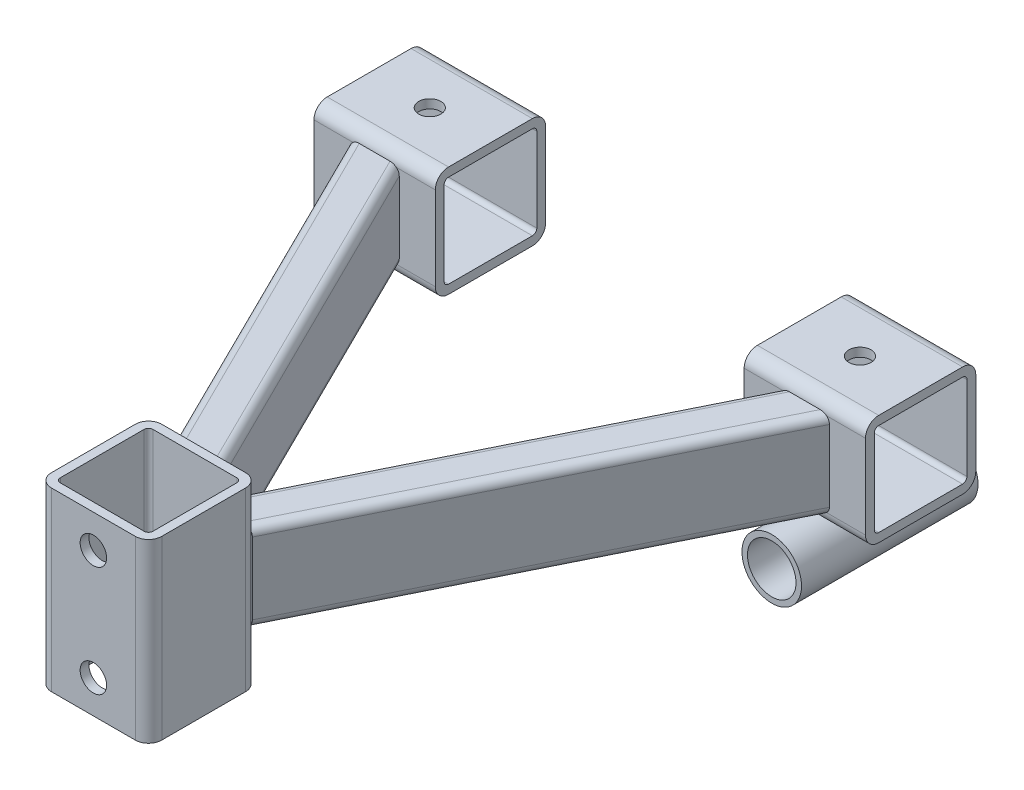
from build123d import *

# Parameters (mm, degrees)
BXBXS_8639_82_50_X_50_X_4_1_DEPTH     = 55
BXBXS_8639_82_50_X_50_X_4_1_2_DEPTH   = 55
AXBXS_8645_68_40_X_20_X_2_5_1_DEPTH   = 266.089245937
AXBXS_8645_68_40_X_20_X_2_5_1_2_DEPTH = 266.089245937
BODY_START                            = 266.089246039
BODY_4_RUN_ON_DEPTH                   = 57.009711
BODY_START_2                          = -2e-09
BODY_3_RUN_ON_DEPTH                   = 57.009711
BXBXS_8639_82_50_X_50_X_4_2_DEPTH     = 80
BODY_START_3                          = 150.660137769
BODY_3_RUN_ON_2_DEPTH                 = 102.6688631
BODY_START_4                          = 115.429108279
BODY_4_RUN_ON_2_DEPTH                 = 102.6688631
SKETCH_9_R                            = 6
CUT_EXTRUDE_1_DEPTH                   = 4
EXTRUDE_1_DEPTH                       = 40
EXTRUDE_1_DEPTH_BACK                  = 40
SKETCH_10_R                           = 13.5
SKETCH_10_R_2                         = 11
CUT_EXTRUDE_2_REACH                   = 296.26
CUT_EXTRUDE_2_END_RADIUS              = 11
SKETCH_11_R                           = 5
SKETCH_12_R                           = 5
CUT_EXTRUDE_3_DEPTH                   = 4


with BuildPart() as part:
    # Sketch1 → Труба bxbxs гост8639-82 50 X 50 X 4(1) (new body)
    with BuildSketch(Plane.ZY.offset(70)):
        with BuildLine():
            Line((-19, -25), (19, -25))
            ThreePointArc((19, -25), (23.242640687, -23.242640687), (25, -19))
            Line((25, -19), (25, 19))
            ThreePointArc((25, 19), (23.242640687, 23.242640687), (19, 25))
            Line((19, 25), (-19, 25))
            ThreePointArc((-19, 25), (-23.242640687, 23.242640687), (-25, 19))
            Line((-25, 19), (-25, -19))
            ThreePointArc((-25, -19), (-23.242640687, -23.242640687), (-19, -25))
        make_face()
        with BuildLine():
            Line((-19, -21), (19, -21))
            ThreePointArc((19, -21), (20.414213562, -20.414213562), (21, -19))
            Line((21, -19), (21, 19))
            ThreePointArc((21, 19), (20.414213562, 20.414213562), (19, 21))
            Line((19, 21), (-19, 21))
            ThreePointArc((-19, 21), (-20.414213562, 20.414213562), (-21, 19))
            Line((-21, 19), (-21, -19))
            ThreePointArc((-21, -19), (-20.414213562, -20.414213562), (-19, -21))
        make_face(mode=Mode.SUBTRACT)
    extrude(amount=BXBXS_8639_82_50_X_50_X_4_1_DEPTH)


with BuildPart() as body_2:
    # Sketch1 on segment 2 (carried to segment 2) → bxbxs _8639-82 50 X 50 X 4_1 2 (new body)
    with BuildSketch(Plane.ZY.offset(-125)):
        with BuildLine():
            Line((-19, -25), (19, -25))
            ThreePointArc((19, -25), (23.242640687, -23.242640687), (25, -19))
            Line((25, -19), (25, 19))
            ThreePointArc((25, 19), (23.242640687, 23.242640687), (19, 25))
            Line((19, 25), (-19, 25))
            ThreePointArc((-19, 25), (-23.242640687, 23.242640687), (-25, 19))
            Line((-25, 19), (-25, -19))
            ThreePointArc((-25, -19), (-23.242640687, -23.242640687), (-19, -25))
        make_face()
        with BuildLine():
            Line((-19, -21), (19, -21))
            ThreePointArc((19, -21), (20.414213562, -20.414213562), (21, -19))
            Line((21, -19), (21, 19))
            ThreePointArc((21, 19), (20.414213562, 20.414213562), (19, 21))
            Line((19, 21), (-19, 21))
            ThreePointArc((-19, 21), (-20.414213562, 20.414213562), (-21, 19))
            Line((-21, 19), (-21, -19))
            ThreePointArc((-21, -19), (-20.414213562, -20.414213562), (-19, -21))
        make_face(mode=Mode.SUBTRACT)
    extrude(amount=BXBXS_8639_82_50_X_50_X_4_1_2_DEPTH)


with BuildPart() as body_3:
    # Sketch11 → Труба axbxs гост8645-68 40 X 20 X 2.5(1) (new body)
    with BuildSketch(Plane(origin=(-97.5, 0, 25), x_dir=(0.8963205535774442, 0, -0.44340665898768833), z_dir=(0.44340665898768833, 0, 0.8963205535774442))):
        with BuildLine():
            Line((-6.25, -20), (6.25, -20))
            ThreePointArc((6.25, -20), (8.901650429, -18.901650429), (10, -16.25))
            Line((10, -16.25), (10, 16.25))
            ThreePointArc((10, 16.25), (8.901650429, 18.901650429), (6.25, 20))
            Line((6.25, 20), (-6.25, 20))
            ThreePointArc((-6.25, 20), (-8.901650429, 18.901650429), (-10, 16.25))
            Line((-10, 16.25), (-10, -16.25))
            ThreePointArc((-10, -16.25), (-8.901650429, -18.901650429), (-6.25, -20))
        make_face()
        with BuildLine():
            Line((-6.25, -17.5), (6.25, -17.5))
            ThreePointArc((6.25, -17.5), (7.133883476, -17.133883476), (7.5, -16.25))
            Line((7.5, -16.25), (7.5, 16.25))
            ThreePointArc((7.5, 16.25), (7.133883476, 17.133883476), (6.25, 17.5))
            Line((6.25, 17.5), (-6.25, 17.5))
            ThreePointArc((-6.25, 17.5), (-7.133883476, 17.133883476), (-7.5, 16.25))
            Line((-7.5, 16.25), (-7.5, -16.25))
            ThreePointArc((-7.5, -16.25), (-7.133883476, -17.133883476), (-6.25, -17.5))
        make_face(mode=Mode.SUBTRACT)
    extrude(amount=AXBXS_8645_68_40_X_20_X_2_5_1_DEPTH)

    # Труба axbxs гост8645-68 40 X 20 X 2.5(1) mitre 1
    split(bisect_by=Plane(origin=(0, 0, 222.090531237), x_dir=(0, -1, 0), z_dir=(-1, 0, 0)), keep=Keep.TOP)

    # Sketch11 → body 3 run on (add)
    with BuildSketch(Plane(origin=(-97.5, 0, 25), x_dir=(0.8963205535774442, 0, -0.44340665898768833), z_dir=(0.44340665898768833, 0, 0.8963205535774442)).offset(BODY_START_2)):
        with BuildLine():
            Line((-6.25, -20), (6.25, -20))
            ThreePointArc((6.25, -20), (8.901650429, -18.901650429), (10, -16.25))
            Line((10, -16.25), (10, 16.25))
            ThreePointArc((10, 16.25), (8.901650429, 18.901650429), (6.25, 20))
            Line((6.25, 20), (-6.25, 20))
            ThreePointArc((-6.25, 20), (-8.901650429, 18.901650429), (-10, 16.25))
            Line((-10, 16.25), (-10, -16.25))
            ThreePointArc((-10, -16.25), (-8.901650429, -18.901650429), (-6.25, -20))
        make_face()
        with BuildLine():
            Line((-6.25, -17.5), (6.25, -17.5))
            ThreePointArc((6.25, -17.5), (7.133883476, -17.133883476), (7.5, -16.25))
            Line((7.5, -16.25), (7.5, 16.25))
            ThreePointArc((7.5, 16.25), (7.133883476, 17.133883476), (6.25, 17.5))
            Line((6.25, 17.5), (-6.25, 17.5))
            ThreePointArc((-6.25, 17.5), (-7.133883476, 17.133883476), (-7.5, 16.25))
            Line((-7.5, 16.25), (-7.5, -16.25))
            ThreePointArc((-7.5, -16.25), (-7.133883476, -17.133883476), (-6.25, -17.5))
        make_face(mode=Mode.SUBTRACT)
    extrude(amount=-BODY_3_RUN_ON_DEPTH)

    # Weld Trim 3 5
    split(bisect_by=Plane(origin=(-97.5, 0, 25), x_dir=(0, -1, 0), z_dir=(0, 0, 1)), keep=Keep.TOP)

    # body 3 cut square before the run-on
    split(bisect_by=Plane(origin=(-30.696291668, 0, 160.03977815), x_dir=(0, -1, 0), z_dir=(-0.443406659, 0, -0.896320554)), keep=Keep.TOP)

    # Sketch11 → body 3 run on 2 (add)
    with BuildSketch(Plane(origin=(-97.5, 0, 25), x_dir=(0.8963205535774442, 0, -0.44340665898768833), z_dir=(0.44340665898768833, 0, 0.8963205535774442)).offset(BODY_START_3)):
        with BuildLine():
            Line((-6.25, -20), (6.25, -20))
            ThreePointArc((6.25, -20), (8.901650429, -18.901650429), (10, -16.25))
            Line((10, -16.25), (10, 16.25))
            ThreePointArc((10, 16.25), (8.901650429, 18.901650429), (6.25, 20))
            Line((6.25, 20), (-6.25, 20))
            ThreePointArc((-6.25, 20), (-8.901650429, 18.901650429), (-10, 16.25))
            Line((-10, 16.25), (-10, -16.25))
            ThreePointArc((-10, -16.25), (-8.901650429, -18.901650429), (-6.25, -20))
        make_face()
        with BuildLine():
            Line((-6.25, -17.5), (6.25, -17.5))
            ThreePointArc((6.25, -17.5), (7.133883476, -17.133883476), (7.5, -16.25))
            Line((7.5, -16.25), (7.5, 16.25))
            ThreePointArc((7.5, 16.25), (7.133883476, 17.133883476), (6.25, 17.5))
            Line((6.25, 17.5), (-6.25, 17.5))
            ThreePointArc((-6.25, 17.5), (-7.133883476, 17.133883476), (-7.5, 16.25))
            Line((-7.5, 16.25), (-7.5, -16.25))
            ThreePointArc((-7.5, -16.25), (-7.133883476, -17.133883476), (-6.25, -17.5))
        make_face(mode=Mode.SUBTRACT)
    extrude(amount=BODY_3_RUN_ON_2_DEPTH)

    # Weld Trim 4
    split(bisect_by=Plane.YX.offset(-200), keep=Keep.TOP)


with BuildPart() as body_4:
    # Sketch11 on segment 2 (carried to segment 2) → axbxs _8645-68 40 X 20 X 2.5_1 2 (new body)
    with BuildSketch(Plane(origin=(-20.485743533, 0, 263.501260219), x_dir=(-0.896320554, 0, -0.443406659), z_dir=(0.443406659, 0, -0.896320554))):
        with BuildLine():
            Line((-6.25, -20), (6.25, -20))
            ThreePointArc((6.25, -20), (8.901650429, -18.901650429), (10, -16.25))
            Line((10, -16.25), (10, 16.25))
            ThreePointArc((10, 16.25), (8.901650429, 18.901650429), (6.25, 20))
            Line((6.25, 20), (-6.25, 20))
            ThreePointArc((-6.25, 20), (-8.901650429, 18.901650429), (-10, 16.25))
            Line((-10, 16.25), (-10, -16.25))
            ThreePointArc((-10, -16.25), (-8.901650429, -18.901650429), (-6.25, -20))
        make_face()
        with BuildLine():
            Line((-6.25, -17.5), (6.25, -17.5))
            ThreePointArc((6.25, -17.5), (7.133883476, -17.133883476), (7.5, -16.25))
            Line((7.5, -16.25), (7.5, 16.25))
            ThreePointArc((7.5, 16.25), (7.133883476, 17.133883476), (6.25, 17.5))
            Line((6.25, 17.5), (-6.25, 17.5))
            ThreePointArc((-6.25, 17.5), (-7.133883476, 17.133883476), (-7.5, 16.25))
            Line((-7.5, 16.25), (-7.5, -16.25))
            ThreePointArc((-7.5, -16.25), (-7.133883476, -17.133883476), (-6.25, -17.5))
        make_face(mode=Mode.SUBTRACT)
    extrude(amount=AXBXS_8645_68_40_X_20_X_2_5_1_2_DEPTH)

    # axbxs _8645-68 40 X 20 X 2.5_1 2 mitre 1
    split(bisect_by=Plane(origin=(0, 0, 222.090531237), x_dir=(0, 1, 0), z_dir=(1, 0, 0)), keep=Keep.TOP)

    # Sketch11 on segment 2 (carried to segment 2) → body 4 run on (add)
    with BuildSketch(Plane(origin=(-20.485743533, 0, 263.501260219), x_dir=(-0.896320554, 0, -0.443406659), z_dir=(0.443406659, 0, -0.896320554)).offset(BODY_START)):
        with BuildLine():
            Line((-6.25, -20), (6.25, -20))
            ThreePointArc((6.25, -20), (8.901650429, -18.901650429), (10, -16.25))
            Line((10, -16.25), (10, 16.25))
            ThreePointArc((10, 16.25), (8.901650429, 18.901650429), (6.25, 20))
            Line((6.25, 20), (-6.25, 20))
            ThreePointArc((-6.25, 20), (-8.901650429, 18.901650429), (-10, 16.25))
            Line((-10, 16.25), (-10, -16.25))
            ThreePointArc((-10, -16.25), (-8.901650429, -18.901650429), (-6.25, -20))
        make_face()
        with BuildLine():
            Line((-6.25, -17.5), (6.25, -17.5))
            ThreePointArc((6.25, -17.5), (7.133883476, -17.133883476), (7.5, -16.25))
            Line((7.5, -16.25), (7.5, 16.25))
            ThreePointArc((7.5, 16.25), (7.133883476, 17.133883476), (6.25, 17.5))
            Line((6.25, 17.5), (-6.25, 17.5))
            ThreePointArc((-6.25, 17.5), (-7.133883476, 17.133883476), (-7.5, 16.25))
            Line((-7.5, 16.25), (-7.5, -16.25))
            ThreePointArc((-7.5, -16.25), (-7.133883476, -17.133883476), (-6.25, -17.5))
        make_face(mode=Mode.SUBTRACT)
    extrude(amount=BODY_4_RUN_ON_DEPTH)

    # Weld Trim 2 5
    split(bisect_by=Plane(origin=(97.5, 0, 25), x_dir=(0, -1, 0), z_dir=(0, 0, 1)), keep=Keep.TOP)

    # body 4 cut square before the run-on
    split(bisect_by=Plane(origin=(30.69629172, 0, 160.039777939), x_dir=(0, 1, 0), z_dir=(0.443406659, 0, -0.896320554)), keep=Keep.TOP)

    # Sketch11 on segment 2 (carried to segment 2) → body 4 run on 2 (add)
    with BuildSketch(Plane(origin=(-20.485743533, 0, 263.501260219), x_dir=(-0.896320554, 0, -0.443406659), z_dir=(0.443406659, 0, -0.896320554)).offset(BODY_START_4)):
        with BuildLine():
            Line((-6.25, -20), (6.25, -20))
            ThreePointArc((6.25, -20), (8.901650429, -18.901650429), (10, -16.25))
            Line((10, -16.25), (10, 16.25))
            ThreePointArc((10, 16.25), (8.901650429, 18.901650429), (6.25, 20))
            Line((6.25, 20), (-6.25, 20))
            ThreePointArc((-6.25, 20), (-8.901650429, 18.901650429), (-10, 16.25))
            Line((-10, 16.25), (-10, -16.25))
            ThreePointArc((-10, -16.25), (-8.901650429, -18.901650429), (-6.25, -20))
        make_face()
        with BuildLine():
            Line((-6.25, -17.5), (6.25, -17.5))
            ThreePointArc((6.25, -17.5), (7.133883476, -17.133883476), (7.5, -16.25))
            Line((7.5, -16.25), (7.5, 16.25))
            ThreePointArc((7.5, 16.25), (7.133883476, 17.133883476), (6.25, 17.5))
            Line((6.25, 17.5), (-6.25, 17.5))
            ThreePointArc((-6.25, 17.5), (-7.133883476, 17.133883476), (-7.5, 16.25))
            Line((-7.5, 16.25), (-7.5, -16.25))
            ThreePointArc((-7.5, -16.25), (-7.133883476, -17.133883476), (-6.25, -17.5))
        make_face(mode=Mode.SUBTRACT)
    extrude(amount=-BODY_4_RUN_ON_2_DEPTH)

    # Weld Trim 4
    split(bisect_by=Plane.YX.offset(-200), keep=Keep.TOP)


with BuildPart() as body_5:
    # Sketch12 → Труба bxbxs гост8639-82 50 X 50 X 4(2) (new body)
    with BuildSketch(Plane(origin=(0, -40, 225), x_dir=(-1, 0, 0), z_dir=(0, 1, 0))):
        with BuildLine():
            Line((-19, -25), (19, -25))
            ThreePointArc((19, -25), (23.242640687, -23.242640687), (25, -19))
            Line((25, -19), (25, 19))
            ThreePointArc((25, 19), (23.242640687, 23.242640687), (19, 25))
            Line((19, 25), (-19, 25))
            ThreePointArc((-19, 25), (-23.242640687, 23.242640687), (-25, 19))
            Line((-25, 19), (-25, -19))
            ThreePointArc((-25, -19), (-23.242640687, -23.242640687), (-19, -25))
        make_face()
        with BuildLine():
            Line((-19, -21), (19, -21))
            ThreePointArc((19, -21), (20.414213562, -20.414213562), (21, -19))
            Line((21, -19), (21, 19))
            ThreePointArc((21, 19), (20.414213562, 20.414213562), (19, 21))
            Line((19, 21), (-19, 21))
            ThreePointArc((-19, 21), (-20.414213562, 20.414213562), (-21, 19))
            Line((-21, 19), (-21, -19))
            ThreePointArc((-21, -19), (-20.414213562, -20.414213562), (-19, -21))
        make_face(mode=Mode.SUBTRACT)
    extrude(amount=BXBXS_8639_82_50_X_50_X_4_2_DEPTH)

    # Эскиз9 → Вырез-Вытянуть1 (cut)
    with BuildSketch(Plane.XY.offset(250)):
        with Locations((0, 25)):
            Circle(SKETCH_9_R)
        with Locations((0, -25)):
            Circle(SKETCH_9_R)
    extrude(amount=-CUT_EXTRUDE_1_DEPTH, mode=Mode.SUBTRACT)


with BuildPart() as body_6:
    # Эскиз10 → Бобышка-Вытянуть1 (new, two sides: drawn at the far end of the back side and taken through both)
    with BuildSketch(Plane.XY.offset(-EXTRUDE_1_DEPTH_BACK)):
        with Locations((97.5, -38.5)):
            Circle(SKETCH_10_R)
        with Locations((97.5, -38.5)):
            Circle(SKETCH_10_R_2, mode=Mode.SUBTRACT)
    extrude(amount=EXTRUDE_1_DEPTH + EXTRUDE_1_DEPTH_BACK)

    # Вырез-Вытянуть2: up to this cylinder (the profile starts outside it)
    cut_extrude_2_end = Plane(origin=(97.5, -38.5, 0), z_dir=(0, 0, 1)) * Cylinder(CUT_EXTRUDE_2_END_RADIUS, 615.52, mode=Mode.PRIVATE)
    # Эскиз11 → Вырез-Вытянуть2 (cut, up to the surface)
    with BuildSketch(Plane(origin=(0, -52, 0), x_dir=(-1, 0, 0), z_dir=(0, -1, 0)), mode=Mode.PRIVATE) as cut_extrude_2_sk1:
        with Locations(Location((-97.5, 0, 0), (0, 0, 90))):
            Circle(SKETCH_11_R)
    cut_extrude_2_tool1 = extrude(cut_extrude_2_sk1.sketch, amount=-CUT_EXTRUDE_2_REACH, mode=Mode.PRIVATE) - cut_extrude_2_end
    add(cut_extrude_2_tool1.solids().sort_by_distance((97.5, -52, 0))[0], mode=Mode.SUBTRACT)


with BuildPart() as cut_extrude_3_tool:
    # Эскиз12 → Вырез-Вытянуть3 (new body)
    with BuildSketch(Plane(origin=(0, 25, 0), x_dir=(1, 0, 0), z_dir=(0, 1, 0))):
        with Locations(Location((-97.5, 0, 0), (0, 0, 270))):
            Circle(SKETCH_12_R)
        with Locations(Location((97.5, 0, 0), (0, 0, 90))):
            Circle(SKETCH_12_R)
    extrude(amount=-CUT_EXTRUDE_3_DEPTH)


with BuildPart() as part_1:
    add(part.part)

    # Вырез-Вытянуть3: cut by cut_extrude_3_tool
    add(cut_extrude_3_tool.part, mode=Mode.SUBTRACT)


with BuildPart() as body_2_1:
    add(body_2.part)

    # Вырез-Вытянуть3: cut by cut_extrude_3_tool
    add(cut_extrude_3_tool.part, mode=Mode.SUBTRACT)


solid = Compound([body_3.part, body_4.part, body_5.part, body_6.part, part_1.part, body_2_1.part])
